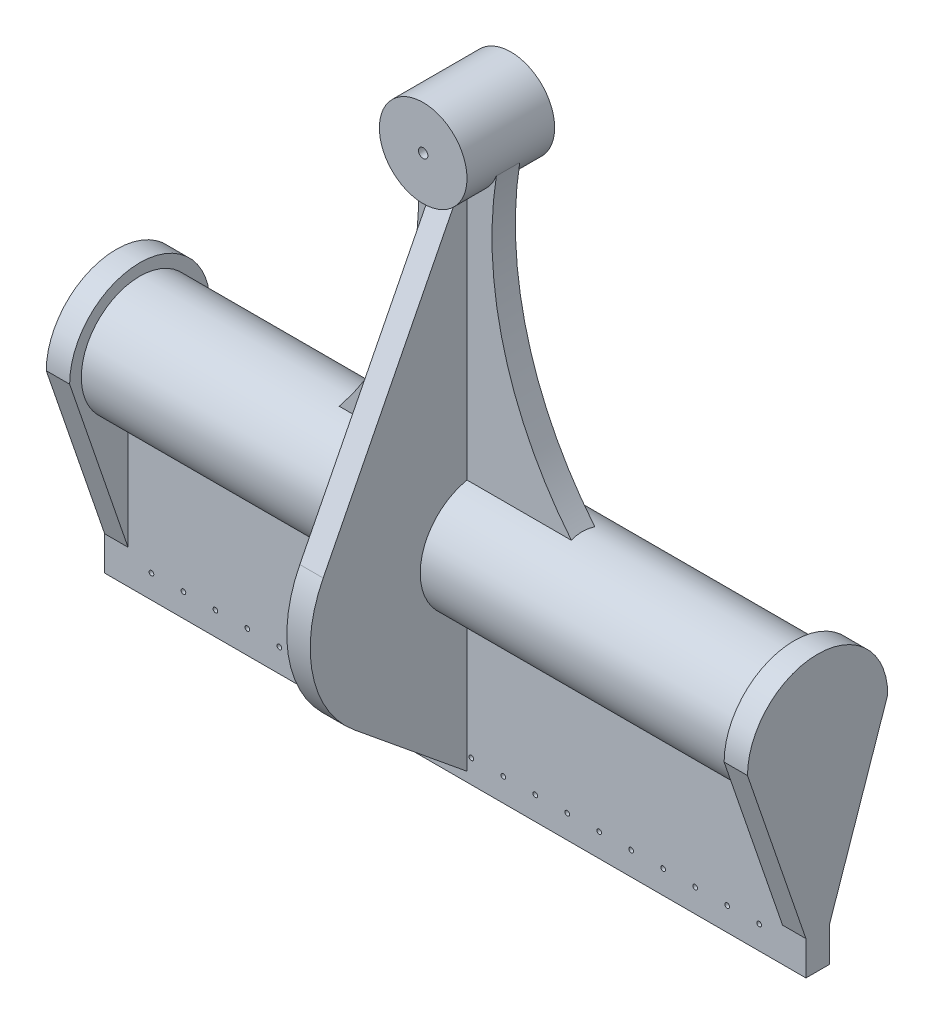
from build123d import *

# Parameters (mm, degrees)
BOSS_EXTRUDE1_DEPTH      = 2.54
BOSS_EXTRUDE1_DEPTH_BACK = 2.54
SKETCH1_W                = 44.45
SKETCH1_H                = 152.4
SKETCH1_R                = 0.508
BOSS_EXTRUDE2_DEPTH      = 76.2
BOSS_EXTRUDE2_DEPTH_BACK = 76.2
SKETCH2_R                = 12.7
BOSS_EXTRUDE3_START      = 71.12
BOSS_EXTRUDE3_DEPTH      = 5.08
BOSS_EXTRUDE4_START      = -76.2
BOSS_EXTRUDE4_DEPTH      = 5.08
BOSS_EXTRUDE5_DEPTH      = 2.54
BOSS_EXTRUDE5_DEPTH_BACK = 2.54
BOSS_EXTRUDE6_DEPTH      = 9.525
BOSS_EXTRUDE6_DEPTH_BACK = 9.525
SKETCH6_R                = 9.525
SKETCH6_R_2              = 1.016
BOSS_EXTRUDE7_DEPTH      = 2.54
BOSS_EXTRUDE7_DEPTH_BACK = 2.54


with BuildPart() as part:
    # Sketch1 → Boss-Extrude1 (new, two sides: drawn at the far end of the back side and taken through both)
    with BuildSketch(Plane(origin=(0, 0, 0), x_dir=(0, 1, 0), z_dir=(0, 0, 1)).offset(-BOSS_EXTRUDE1_DEPTH_BACK)):
        with Locations((-22.225, 0)):
            Rectangle(SKETCH1_W, SKETCH1_H)
        with Locations((-39.37, -66.04)):
            Circle(SKETCH1_R, mode=Mode.SUBTRACT)
        with Locations((-39.37, -59.088421053)):
            Circle(SKETCH1_R, mode=Mode.SUBTRACT)
        with Locations((-39.37, -52.136842105)):
            Circle(SKETCH1_R, mode=Mode.SUBTRACT)
        with Locations((-39.37, -45.185263158)):
            Circle(SKETCH1_R, mode=Mode.SUBTRACT)
        with Locations((-39.37, -38.233684211)):
            Circle(SKETCH1_R, mode=Mode.SUBTRACT)
        with Locations((-39.37, -31.282105263)):
            Circle(SKETCH1_R, mode=Mode.SUBTRACT)
        with Locations((-39.37, -24.330526316)):
            Circle(SKETCH1_R, mode=Mode.SUBTRACT)
        with Locations((-39.37, -17.378947368)):
            Circle(SKETCH1_R, mode=Mode.SUBTRACT)
        with Locations((-39.37, -10.427368421)):
            Circle(SKETCH1_R, mode=Mode.SUBTRACT)
        with Locations((-39.37, -3.475789474)):
            Circle(SKETCH1_R, mode=Mode.SUBTRACT)
        with Locations((-39.37, 3.475789474)):
            Circle(SKETCH1_R, mode=Mode.SUBTRACT)
        with Locations((-39.37, 10.427368421)):
            Circle(SKETCH1_R, mode=Mode.SUBTRACT)
        with Locations((-39.37, 17.378947368)):
            Circle(SKETCH1_R, mode=Mode.SUBTRACT)
        with Locations((-39.37, 24.330526316)):
            Circle(SKETCH1_R, mode=Mode.SUBTRACT)
        with Locations((-39.37, 31.282105263)):
            Circle(SKETCH1_R, mode=Mode.SUBTRACT)
        with Locations((-39.37, 38.233684211)):
            Circle(SKETCH1_R, mode=Mode.SUBTRACT)
        with Locations((-39.37, 45.185263158)):
            Circle(SKETCH1_R, mode=Mode.SUBTRACT)
        with Locations((-39.37, 52.136842105)):
            Circle(SKETCH1_R, mode=Mode.SUBTRACT)
        with Locations((-39.37, 59.088421053)):
            Circle(SKETCH1_R, mode=Mode.SUBTRACT)
        with Locations((-39.37, 66.04)):
            Circle(SKETCH1_R, mode=Mode.SUBTRACT)
    extrude(amount=BOSS_EXTRUDE1_DEPTH + BOSS_EXTRUDE1_DEPTH_BACK)

    # Sketch2 → Boss-Extrude2 (add, two sides: drawn at the far end of the back side and taken through both)
    with BuildSketch(Plane.YZ.offset(-BOSS_EXTRUDE2_DEPTH_BACK)):
        Circle(SKETCH2_R)
    extrude(amount=BOSS_EXTRUDE2_DEPTH + BOSS_EXTRUDE2_DEPTH_BACK)

    # Sketch3 → Boss-Extrude3 (add)
    with BuildSketch(Plane.YZ.offset(BOSS_EXTRUDE3_START)):
        with BuildLine():
            Line((0, 15.24), (-44.45, 0))
            Line((-44.45, 0), (0, -15.24))
            ThreePointArc((0, -15.24), (15.24, 0), (0, 15.24))
        make_face()
    extrude(amount=BOSS_EXTRUDE3_DEPTH)

    # Sketch4 → Boss-Extrude4 (add)
    with BuildSketch(Plane.YZ.offset(BOSS_EXTRUDE4_START)):
        with BuildLine():
            Line((0, 15.24), (-44.45, 0))
            Line((-44.45, 0), (0, -15.24))
            ThreePointArc((0, -15.24), (15.24, 0), (0, 15.24))
        make_face()
    extrude(amount=BOSS_EXTRUDE4_DEPTH)

    # Sketch5 → Boss-Extrude5 (add, two sides: drawn at the far end of the back side and taken through both)
    with BuildSketch(Plane(origin=(0, 0, 0), x_dir=(0, 1, 0), z_dir=(0, 0, 1)).offset(-BOSS_EXTRUDE5_DEPTH_BACK)):
        with BuildLine():
            Line((0, -38.1), (0, 38.1))
            ThreePointArc((0, 38.1), (33.985630195, 12.840847186), (76.2, 9.525))
            Line((76.2, 9.525), (76.2, -9.525))
            ThreePointArc((76.2, -9.525), (33.985630195, -12.840847186), (0, -38.1))
        make_face()
    extrude(amount=BOSS_EXTRUDE5_DEPTH + BOSS_EXTRUDE5_DEPTH_BACK)

    # Sketch6 → Boss-Extrude6 (add, two sides: drawn at the far end of the back side and taken through both)
    with BuildSketch(Plane(origin=(0, 0, 0), x_dir=(0, 1, 0), z_dir=(0, 0, 1)).offset(-BOSS_EXTRUDE6_DEPTH_BACK)):
        with Locations((76.2, 0)):
            Circle(SKETCH6_R)
        with Locations((76.2, 0)):
            Circle(SKETCH6_R_2, mode=Mode.SUBTRACT)
    extrude(amount=BOSS_EXTRUDE6_DEPTH + BOSS_EXTRUDE6_DEPTH_BACK)

    # Sketch7 → Boss-Extrude7 (add, two sides: drawn at the far end of the back side and taken through both)
    with BuildSketch(Plane.YZ.offset(-BOSS_EXTRUDE7_DEPTH_BACK)):
        with BuildLine():
            Line((-44.45, 0), (-22.314431846, 27.064186346))
            ThreePointArc((-22.314431846, 27.064186346), (-7.52969852, 36.057533993), (9.627162737, 33.796836486))
            Line((9.627162737, 33.796836486), (76.2, 0))
            Line((76.2, 0), (3.048089123, -14.93207128))
            ThreePointArc((3.048089123, -14.93207128), (-4.676176886, -15.336226713), (-12.178352745, -13.453413825))
            Line((-12.178352745, -13.453413825), (-44.45, 0))
        make_face()
    extrude(amount=BOSS_EXTRUDE7_DEPTH + BOSS_EXTRUDE7_DEPTH_BACK)


solid = part.part
